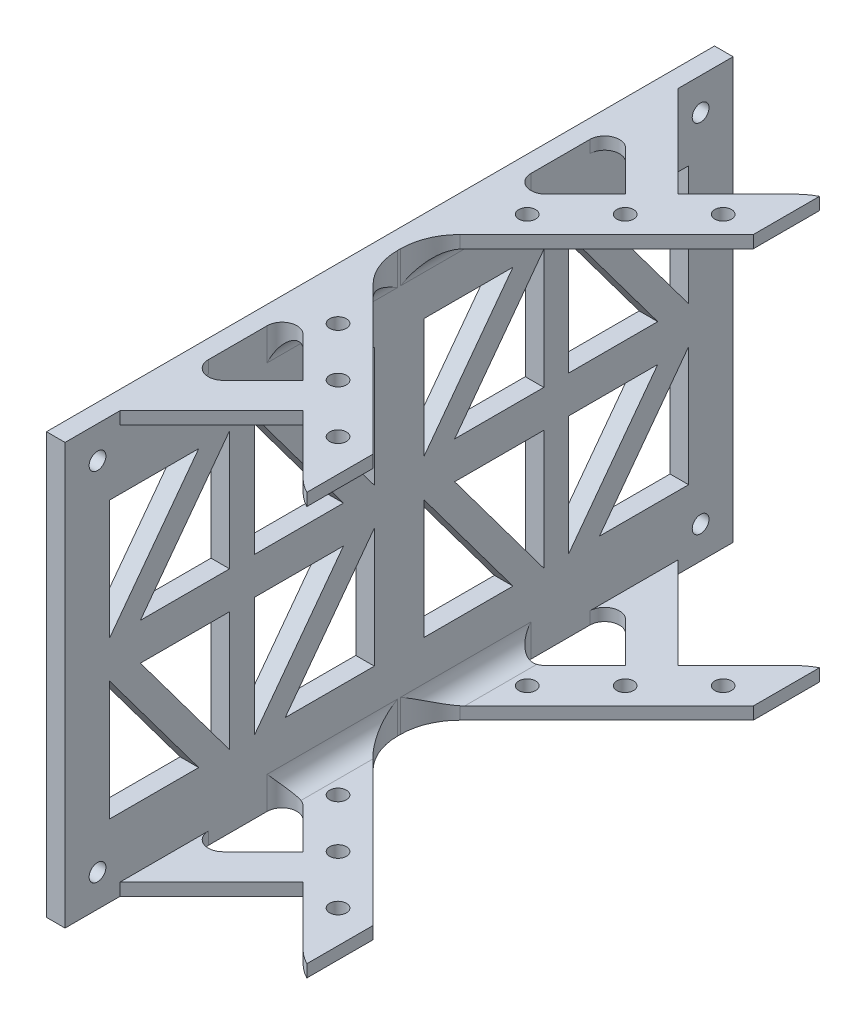
from build123d import *

# Parameters (mm, degrees)
BOSS_EXTRUDE2_DEPTH                        = 3.175
SKETCH7_R                                  = 2.15265
CUT_EXTRUDE1_DEPTH                         = 117.966563811
FILLET1_R                                  = 15.24
FILLET3_R                                  = 5.08
SKETCH8_W                                  = 56.648289357
SKETCH8_H                                  = 101.198808444
CUT_EXTRUDE2_DEPTH                         = 7.62
BOSS_EXTRUDE3_START                        = -3.175
SKETCH9_W                                  = 4.7625
SKETCH9_H                                  = 171.45
BOSS_EXTRUDE3_DEPTH                        = 53.975
BOSS_EXTRUDE4_DEPTH                        = 3.175
FILLET5_R                                  = 15.24
FILLET6_R                                  = 3.81
FILLET7_R                                  = 5.08
SKETCH11_W                                 = 46.21084725
SKETCH11_H                                 = 180.918535255
CUT_EXTRUDE4_DEPTH                         = 6.35
SKETCH12_R                                 = 2.15265
CUT_EXTRUDE5_DEPTH                         = 145.138021455
MIRROR7_AT_THE_SECOND_PLANE_COPY_1_SKETC_R = 2.15265
MIRROR7_AT_THE_SECOND_PLANE_COPY_1_DEPTH   = 145.138021455
CUT_EXTRUDE6_DEPTH                         = 145.138021455
MIRROR9_COPY_1_DEPTH                       = 145.138021455
MIRROR9_AT_THE_SECOND_PLANE_COPY_1_DEPTH   = 145.138021455
MIRROR9_AT_THE_SECOND_PLANE_COPY_2_DEPTH   = 145.138021455
MIRROR9_AT_THE_SECOND_PLANE_COPY_3_DEPTH   = 145.138021455


with BuildPart() as part:
    # Sketch1 → Boss-Extrude2 (new body)
    with BuildSketch(Plane(origin=(0, 0, 0), x_dir=(1, 0, 0), z_dir=(0, 1, 0))):
        Polygon((-82.677748493, 0), (0, -82.677), (0, -64.716569057), (-64.71715495, 0), align=None)
    boss_extrude2 = extrude(amount=BOSS_EXTRUDE2_DEPTH)

    # Mirror1: Boss-Extrude2 across plane
    add(boss_extrude2.mirror(Plane.XY))

    # Sketch7 → Cut-Extrude1 (cut, through all)
    with BuildSketch(Plane(origin=(0, 3.175, 0), x_dir=(1, 0, 0), z_dir=(0, 1, 0))):
        with Locations(Location((-36.848766511, -36.848351615, 0), (0, 0, 270))):
            Circle(SKETCH7_R)
        with Locations(Location((-49.42112508, -24.275993045, 0), (0, 0, 270))):
            Circle(SKETCH7_R)
        with Locations(Location((-24.276407941, -49.420710184, 0), (0, 0, 270))):
            Circle(SKETCH7_R)
    cut_extrude1 = extrude(amount=-CUT_EXTRUDE1_DEPTH, mode=Mode.SUBTRACT)

    # Mirror2: Cut-Extrude1 across plane
    add(cut_extrude1.mirror(Plane.XY), mode=Mode.SUBTRACT)

    # Fillet1
    # the kernel refuses this fillet: 15.24 mm, written as the material it takes off along each edge
    with BuildSketch(Plane(origin=(0, -69.316819186, 82.677), x_dir=(-0.7071099819596416, 0, -0.707103580398965), z_dir=(0, 1, 0))) as fillet1_piece_1:
        with BuildLine():
            CenterArc((27.726727674, -15.24), FILLET1_R, 90, 80.405931773)
            Line((12.699885025, -12.7), (12.399348172, -12.6492))
            ThreePointArc((12.399348172, -12.6492), (6.13441539, -6.565525171), (-0.215527123, -0.215525171))
            Line((-0.215527123, -0.215525171), (0, 0.3048))
            Line((0, 0.3048), (27.726727674, 0.3048))
            Line((27.726727674, 0.3048), (27.726727674, 0))
        make_face()
    extrude(amount=141.808638371, mode=Mode.SUBTRACT)
    with BuildSketch(Plane(origin=(0, -69.316819186, -82.677), x_dir=(-0.7071099819596416, 0, 0.707103580398965), z_dir=(0, 1, 0))) as fillet1_piece_2:
        with BuildLine():
            CenterArc((27.726727674, 15.24), FILLET1_R, 189.594068227, 80.405931773)
            Line((12.699885025, 12.7), (12.399348172, 12.6492))
            ThreePointArc((12.399348172, 12.6492), (6.13441539, 6.565525171), (-0.215527123, 0.215525171))
            Line((-0.215527123, 0.215525171), (0, -0.3048))
            Line((0, -0.3048), (27.726727674, -0.3048))
            Line((27.726727674, -0.3048), (27.726727674, 0))
        make_face()
    extrude(amount=141.808638371, mode=Mode.SUBTRACT)

    # Fillet3
    fillet3_edges = [part.edges().sort_by_distance(p)[0] for p in [
        (-82.677748493, 1.5875, 0),
    ]]
    fillet(fillet3_edges, radius=FILLET3_R)

    # Sketch8 → Cut-Extrude2 (cut)
    with BuildSketch(Plane(origin=(0, 3.175, 0), x_dir=(1, 0, 0), z_dir=(0, 1, 0))):
        with Locations((-91.117655755, -9.895214756)):
            Rectangle(SKETCH8_W, SKETCH8_H)
    extrude(amount=-CUT_EXTRUDE2_DEPTH, mode=Mode.SUBTRACT)


with BuildPart() as cut_extrude2_piece_1:
    # of the separate pieces the step leaves, piece 1, a body of its own (cut_extrude2_pieces)
    add(part.part.solids().sort_by_distance((-62.793511076, 0, -19.884057402))[0])



with BuildPart() as cut_extrude2_piece_2:
    # of the separate pieces the step leaves, piece 2, a body of its own (cut_extrude2_pieces)
    add(part.part.solids().sort_by_distance((-62.793511076, 0, 19.884057402))[0])


with BuildPart() as cut_extrude2_piece_1_1:
    add(cut_extrude2_piece_1.part)

    add(cut_extrude2_piece_2.part)  # Boss-Extrude3 merges Cut-Extrude2 piece 2
    # Sketch9 → Boss-Extrude3 (add)
    with BuildSketch(Plane(origin=(0, 3.175, 0), x_dir=(1, 0, 0), z_dir=(0, 1, 0)).offset(BOSS_EXTRUDE3_START)):
        with Locations((-60.412261076, 0)):
            Rectangle(SKETCH9_W, SKETCH9_H)
    extrude(amount=BOSS_EXTRUDE3_DEPTH)

    # Sketch15 → Boss-Extrude4 (add)
    with BuildSketch(Plane.XZ):
        Polygon((-41.282048711, 41.395325021), (-58.031011076, 58.144439017), (-58.031011076, 71.614884174), (-34.546826133, 48.130486624), align=None)
    boss_extrude4 = extrude(amount=-BOSS_EXTRUDE4_DEPTH)

    # Mirror10: Boss-Extrude4 across plane
    add(boss_extrude4.mirror(Plane.XY))

    # Fillet5
    fillet5_edges = [cut_extrude2_piece_1_1.edges().sort_by_distance(p)[0] for p in [
        (-58.031011076, 1.5875, 6.686083344),
        (-58.031011076, 1.5875, -6.686083344),
    ]]
    fillet(fillet5_edges, radius=FILLET5_R)

    # Fillet6
    fillet6_edges = [cut_extrude2_piece_1_1.edges().sort_by_distance(p)[0] for p in [
        (-58.031011076, 1.5875, 24.646514287),
        (-58.031011076, 1.5875, -24.646514287),
        (-58.031011076, 1.5875, 58.144439017),
        (-58.031011076, 1.5875, -58.144439017),
    ]]
    fillet(fillet6_edges, radius=FILLET6_R)

    # Fillet7
    fillet7_edges = [cut_extrude2_piece_1_1.edges().sort_by_distance(p)[0] for p in [
        (-58.031011076, 3.175, 17.10901866),
        (-58.031011076, 3.175, -17.10901866),
    ]]
    fillet(fillet7_edges, radius=FILLET7_R)

    # Sketch11 → Cut-Extrude4 (cut)
    with BuildSketch(Plane(origin=(0, 3.175, 0), x_dir=(1, 0, 0), z_dir=(0, 1, 0))):
        with Locations((7.190811759, 0.451962324)):
            Rectangle(SKETCH11_W, SKETCH11_H)
    extrude(amount=-CUT_EXTRUDE4_DEPTH, mode=Mode.SUBTRACT)

    # Mirror6: Cut-Extrude2 piece 1 across plane


with BuildPart() as cut_extrude2_piece_1_2:
    add(cut_extrude2_piece_1_1.part)
    add(cut_extrude2_piece_1_1.part.mirror(Plane.ZX.offset(53.975)))

    # Sketch12 → Cut-Extrude5 (cut, through all)
    with BuildSketch(Plane(origin=(-58.031011076, 0, 0), x_dir=(0, 0, -1), z_dir=(1, 0, 0))):
        with Locations((-77.390625, 99.695)):
            Circle(SKETCH12_R)
    cut_extrude5 = extrude(amount=-CUT_EXTRUDE5_DEPTH, mode=Mode.SUBTRACT)

    # Mirror7: Cut-Extrude5 across plane
    add(cut_extrude5.mirror(Plane.XY), mode=Mode.SUBTRACT)

    # Mirror7 at the second plane: Cut-Extrude5 across plane
    add(cut_extrude5.mirror(Plane(origin=(0, 53.975, 0), x_dir=(0, 0, 1), z_dir=(0, -1, 0))), mode=Mode.SUBTRACT)

    # Mirror7 at the second plane copy 1 sketc → Mirror7 at the second plane copy 1 (cut, through all)
    with BuildSketch(Plane(origin=(-58.031011076, 107.95, 0), x_dir=(0, 0, 1), z_dir=(1, 0, 0))):
        with Locations((-77.390625, 99.695)):
            Circle(MIRROR7_AT_THE_SECOND_PLANE_COPY_1_SKETC_R)
    extrude(amount=-MIRROR7_AT_THE_SECOND_PLANE_COPY_1_DEPTH, mode=Mode.SUBTRACT)

    # Sketch14 → Cut-Extrude6 (cut, through all)
    with BuildSketch(Plane(origin=(-58.031011076, 0, 0), x_dir=(0, 0, -1), z_dir=(1, 0, 0))):
        Polygon((-6.35, 49.2125), (-6.35, 18.534457549), (-29.232306115, 18.534457549), align=None)
        Polygon((-37.154157331, 18.534457549), (-37.154157331, 49.2125), (-14.271851216, 49.2125), align=None)
    cut_extrude6 = extrude(amount=-CUT_EXTRUDE6_DEPTH, mode=Mode.SUBTRACT)

    # Mirror8: Cut-Extrude6 across plane
    add(cut_extrude6.mirror(Plane(origin=(0, 0, 40.329157331), x_dir=(1, 0, 0), z_dir=(0, 0, -1))), mode=Mode.SUBTRACT)

    # Mirror9: Cut-Extrude6 across plane
    add(cut_extrude6.mirror(Plane(origin=(0, 53.975, 0), x_dir=(0, 0, 1), z_dir=(0, -1, 0))), mode=Mode.SUBTRACT)

    # Mirror9 copy 1 sketch → Mirror9 copy 1 (cut, through all)
    with BuildSketch(Plane(origin=(-58.031011076, 107.95, 80.658314661), x_dir=(0, 0, 1), z_dir=(1, 0, 0))):
        Polygon((-6.35, 49.2125), (-6.35, 18.534457549), (-29.232306115, 18.534457549), align=None)
        Polygon((-37.154157331, 18.534457549), (-37.154157331, 49.2125), (-14.271851216, 49.2125), align=None)
    extrude(amount=-MIRROR9_COPY_1_DEPTH, mode=Mode.SUBTRACT)

    # Mirror9 at the second plane: Cut-Extrude6 across plane
    add(cut_extrude6.mirror(Plane.XY), mode=Mode.SUBTRACT)

    # Mirror9 at the second plane copy 1 sketc → Mirror9 at the second plane copy 1 (cut, through all)
    with BuildSketch(Plane(origin=(-58.031011076, 0, -80.658314661), x_dir=(0, 0, -1), z_dir=(1, 0, 0))):
        Polygon((-6.35, 49.2125), (-6.35, 18.534457549), (-29.232306115, 18.534457549), align=None)
        Polygon((-37.154157331, 18.534457549), (-37.154157331, 49.2125), (-14.271851216, 49.2125), align=None)
    extrude(amount=-MIRROR9_AT_THE_SECOND_PLANE_COPY_1_DEPTH, mode=Mode.SUBTRACT)

    # Mirror9 at the second plane copy 2 sketc → Mirror9 at the second plane copy 2 (cut, through all)
    with BuildSketch(Plane(origin=(-58.031011076, 107.95, 0), x_dir=(0, 0, 1), z_dir=(1, 0, 0))):
        Polygon((-6.35, 49.2125), (-6.35, 18.534457549), (-29.232306115, 18.534457549), align=None)
        Polygon((-37.154157331, 18.534457549), (-37.154157331, 49.2125), (-14.271851216, 49.2125), align=None)
    extrude(amount=-MIRROR9_AT_THE_SECOND_PLANE_COPY_2_DEPTH, mode=Mode.SUBTRACT)

    # Mirror9 at the second plane copy 3 sketc → Mirror9 at the second plane copy 3 (cut, through all)
    with BuildSketch(Plane(origin=(-58.031011076, 107.95, -80.658314661), x_dir=(0, 0, -1), z_dir=(1, 0, 0))):
        Polygon((-6.35, -49.2125), (-6.35, -18.534457549), (-29.232306115, -18.534457549), align=None)
        Polygon((-37.154157331, -18.534457549), (-37.154157331, -49.2125), (-14.271851216, -49.2125), align=None)
    extrude(amount=-MIRROR9_AT_THE_SECOND_PLANE_COPY_3_DEPTH, mode=Mode.SUBTRACT)


solid = cut_extrude2_piece_1_2.part
